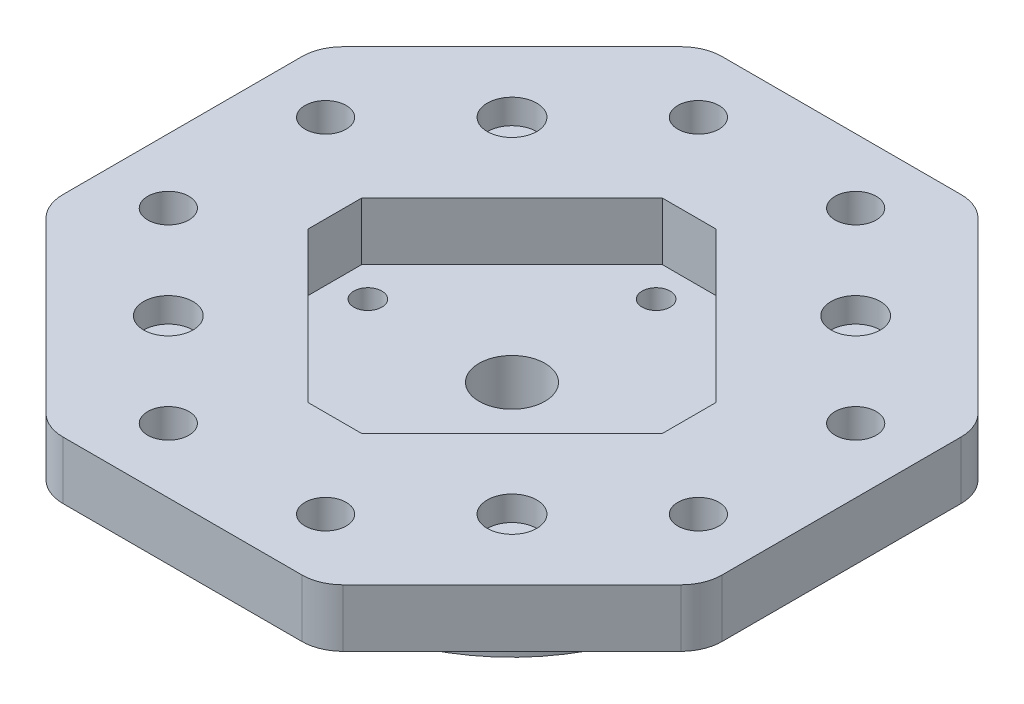
from build123d import *

# Parameters (mm, degrees)
SKETCH_1_R          = 27.5
EXTRUDE_1_DEPTH     = 3
SKETCH_2_R          = 22.5
EXTRUDE_2_DEPTH     = 10
CUT_EXTRUDE_1_REACH = 43.006
SKETCH_3_R          = 1.7
SKETCH_3_R_2        = 4
EXTRUDE_3_DEPTH     = 7
SKETCH_6_R          = 3
CUT_EXTRUDE_2_DEPTH = 3
CUT_EXTRUDE_3_REACH = 62
SKETCH_7_R          = 2.5
FILLET_1_R          = 5


with BuildPart() as part:
    # 草图1 → 凸台-拉伸1 (new body)
    with BuildSketch(Plane(origin=(0, 0, 0), x_dir=(1, 0, 0), z_dir=(0, 1, 0))):
        Circle(SKETCH_1_R)
    extrude(amount=-EXTRUDE_1_DEPTH)

    # 草图2 → 凸台-拉伸2 (add)
    with BuildSketch(Plane.XZ.offset(3)):
        Circle(SKETCH_2_R)
    extrude(amount=EXTRUDE_2_DEPTH)

    # 草图3 → 切除-拉伸1 (cut, up to next)
    with BuildSketch(Plane.XZ.offset(13), mode=Mode.PRIVATE) as cut_extrude_1_sk1:
        with Locations((0, 17.5)):
            Circle(SKETCH_3_R)
    cut_extrude_1_tool1 = extrude(cut_extrude_1_sk1.sketch, amount=-CUT_EXTRUDE_1_REACH, mode=Mode.PRIVATE) & part.part
    # 草图3 → 切除-拉伸1 (cut, up to next)
    with BuildSketch(Plane.XZ.offset(13), mode=Mode.PRIVATE) as cut_extrude_1_sk2:
        with Locations((17.5, 0)):
            Circle(SKETCH_3_R)
    cut_extrude_1_tool2 = extrude(cut_extrude_1_sk2.sketch, amount=-CUT_EXTRUDE_1_REACH, mode=Mode.PRIVATE) & part.part
    # 草图3 → 切除-拉伸1 (cut, up to next)
    with BuildSketch(Plane.XZ.offset(13), mode=Mode.PRIVATE) as cut_extrude_1_sk3:
        with Locations((0, -17.5)):
            Circle(SKETCH_3_R)
    cut_extrude_1_tool3 = extrude(cut_extrude_1_sk3.sketch, amount=-CUT_EXTRUDE_1_REACH, mode=Mode.PRIVATE) & part.part
    # 草图3 → 切除-拉伸1 (cut, up to next)
    with BuildSketch(Plane.XZ.offset(13), mode=Mode.PRIVATE) as cut_extrude_1_sk4:
        with Locations((-17.5, 0)):
            Circle(SKETCH_3_R)
    cut_extrude_1_tool4 = extrude(cut_extrude_1_sk4.sketch, amount=-CUT_EXTRUDE_1_REACH, mode=Mode.PRIVATE) & part.part
    # 草图3 → 切除-拉伸1 (cut, up to next)
    with BuildSketch(Plane.XZ.offset(13), mode=Mode.PRIVATE) as cut_extrude_1_sk5:
        Circle(SKETCH_3_R_2)
    cut_extrude_1_tool5 = extrude(cut_extrude_1_sk5.sketch, amount=-CUT_EXTRUDE_1_REACH, mode=Mode.PRIVATE) & part.part
    add(cut_extrude_1_tool1.solids().sort_by_distance((0, -13, 17.5))[0], mode=Mode.SUBTRACT)
    add(cut_extrude_1_tool2.solids().sort_by_distance((17.5, -13, 0))[0], mode=Mode.SUBTRACT)
    add(cut_extrude_1_tool3.solids().sort_by_distance((0, -13, -17.5))[0], mode=Mode.SUBTRACT)
    add(cut_extrude_1_tool4.solids().sort_by_distance((-17.5, -13, 0))[0], mode=Mode.SUBTRACT)
    add(cut_extrude_1_tool5.solids().sort_by_distance((0, -13, 0))[0], mode=Mode.SUBTRACT)

    # 草图4 → 凸台-拉伸3 (add)
    with BuildSketch(Plane(origin=(0, 0, 0), x_dir=(1, 0, 0), z_dir=(0, 1, 0))):
        Polygon((0, 40), (16.568542495, 40), (40, 16.568542495), (40, 0), (40, -16.568542495), (16.568542495, -40), (0, -40), (-16.568542495, -40), (-40, -16.568542495), (-40, 0), (-40, 16.568542495), (-16.568542495, 40), align=None)
        Polygon((0, 21.5), (3.248737342, 21.5), (21.5, 3.248737342), (21.5, 0), (21.5, -3.248737342), (3.248737342, -21.5), (0, -21.5), (-3.248737342, -21.5), (-21.5, -3.248737342), (-21.5, 0), (-21.5, 3.248737342), (-3.248737342, 21.5), align=None, mode=Mode.SUBTRACT)
    extrude(amount=EXTRUDE_3_DEPTH)

    # 草图6 → 切除-拉伸2 (cut)
    with BuildSketch(Plane(origin=(0, 7, 0), x_dir=(1, 0, 0), z_dir=(0, 1, 0))):
        with Locations((20.859650045, 20.859650045)):
            Circle(SKETCH_6_R)
        with Locations((20.859650045, -20.859650045)):
            Circle(SKETCH_6_R)
        with Locations((-20.859650045, -20.859650045)):
            Circle(SKETCH_6_R)
        with Locations((-20.859650045, 20.859650045)):
            Circle(SKETCH_6_R)
    extrude(amount=-CUT_EXTRUDE_2_DEPTH, mode=Mode.SUBTRACT)

    # 草图7 → 切除-拉伸3 (cut, up to next)
    with BuildSketch(Plane(origin=(0, 7, 0), x_dir=(1, 0, 0), z_dir=(0, 1, 0)), mode=Mode.PRIVATE) as cut_extrude_3_sk1:
        with Locations((9.545941546, 32.173358544)):
            Circle(SKETCH_7_R)
    cut_extrude_3_tool1 = extrude(cut_extrude_3_sk1.sketch, amount=-CUT_EXTRUDE_3_REACH, mode=Mode.PRIVATE) & part.part
    # 草图7 → 切除-拉伸3 (cut, up to next)
    with BuildSketch(Plane(origin=(0, 7, 0), x_dir=(1, 0, 0), z_dir=(0, 1, 0)), mode=Mode.PRIVATE) as cut_extrude_3_sk2:
        with Locations((32.173358544, 9.545941546)):
            Circle(SKETCH_7_R)
    cut_extrude_3_tool2 = extrude(cut_extrude_3_sk2.sketch, amount=-CUT_EXTRUDE_3_REACH, mode=Mode.PRIVATE) & part.part
    # 草图7 → 切除-拉伸3 (cut, up to next)
    with BuildSketch(Plane(origin=(0, 7, 0), x_dir=(1, 0, 0), z_dir=(0, 1, 0)), mode=Mode.PRIVATE) as cut_extrude_3_sk3:
        with Locations((32.173358544, -9.545941546)):
            Circle(SKETCH_7_R)
    cut_extrude_3_tool3 = extrude(cut_extrude_3_sk3.sketch, amount=-CUT_EXTRUDE_3_REACH, mode=Mode.PRIVATE) & part.part
    # 草图7 → 切除-拉伸3 (cut, up to next)
    with BuildSketch(Plane(origin=(0, 7, 0), x_dir=(1, 0, 0), z_dir=(0, 1, 0)), mode=Mode.PRIVATE) as cut_extrude_3_sk4:
        with Locations((9.545941546, -32.173358544)):
            Circle(SKETCH_7_R)
    cut_extrude_3_tool4 = extrude(cut_extrude_3_sk4.sketch, amount=-CUT_EXTRUDE_3_REACH, mode=Mode.PRIVATE) & part.part
    # 草图7 → 切除-拉伸3 (cut, up to next)
    with BuildSketch(Plane(origin=(0, 7, 0), x_dir=(1, 0, 0), z_dir=(0, 1, 0)), mode=Mode.PRIVATE) as cut_extrude_3_sk5:
        with Locations((-9.545941546, -32.173358544)):
            Circle(SKETCH_7_R)
    cut_extrude_3_tool5 = extrude(cut_extrude_3_sk5.sketch, amount=-CUT_EXTRUDE_3_REACH, mode=Mode.PRIVATE) & part.part
    # 草图7 → 切除-拉伸3 (cut, up to next)
    with BuildSketch(Plane(origin=(0, 7, 0), x_dir=(1, 0, 0), z_dir=(0, 1, 0)), mode=Mode.PRIVATE) as cut_extrude_3_sk6:
        with Locations((-32.173358544, -9.545941546)):
            Circle(SKETCH_7_R)
    cut_extrude_3_tool6 = extrude(cut_extrude_3_sk6.sketch, amount=-CUT_EXTRUDE_3_REACH, mode=Mode.PRIVATE) & part.part
    # 草图7 → 切除-拉伸3 (cut, up to next)
    with BuildSketch(Plane(origin=(0, 7, 0), x_dir=(1, 0, 0), z_dir=(0, 1, 0)), mode=Mode.PRIVATE) as cut_extrude_3_sk7:
        with Locations((-32.173358544, 9.545941546)):
            Circle(SKETCH_7_R)
    cut_extrude_3_tool7 = extrude(cut_extrude_3_sk7.sketch, amount=-CUT_EXTRUDE_3_REACH, mode=Mode.PRIVATE) & part.part
    # 草图7 → 切除-拉伸3 (cut, up to next)
    with BuildSketch(Plane(origin=(0, 7, 0), x_dir=(1, 0, 0), z_dir=(0, 1, 0)), mode=Mode.PRIVATE) as cut_extrude_3_sk8:
        with Locations((-9.545941546, 32.173358544)):
            Circle(SKETCH_7_R)
    cut_extrude_3_tool8 = extrude(cut_extrude_3_sk8.sketch, amount=-CUT_EXTRUDE_3_REACH, mode=Mode.PRIVATE) & part.part
    add(cut_extrude_3_tool1.solids().sort_by_distance((9.545942, 7, -32.173359))[0], mode=Mode.SUBTRACT)
    add(cut_extrude_3_tool2.solids().sort_by_distance((32.173359, 7, -9.545942))[0], mode=Mode.SUBTRACT)
    add(cut_extrude_3_tool3.solids().sort_by_distance((32.173359, 7, 9.545942))[0], mode=Mode.SUBTRACT)
    add(cut_extrude_3_tool4.solids().sort_by_distance((9.545942, 7, 32.173359))[0], mode=Mode.SUBTRACT)
    add(cut_extrude_3_tool5.solids().sort_by_distance((-9.545942, 7, 32.173359))[0], mode=Mode.SUBTRACT)
    add(cut_extrude_3_tool6.solids().sort_by_distance((-32.173359, 7, 9.545942))[0], mode=Mode.SUBTRACT)
    add(cut_extrude_3_tool7.solids().sort_by_distance((-32.173359, 7, -9.545942))[0], mode=Mode.SUBTRACT)
    add(cut_extrude_3_tool8.solids().sort_by_distance((-9.545942, 7, -32.173359))[0], mode=Mode.SUBTRACT)

    # 圆角1
    fillet_1_edges = [part.edges().sort_by_distance(p)[0] for p in [
        (-40, 3.5, -16.568542495),
        (-16.568542495, 3.5, -40),
        (16.568542495, 3.5, -40),
        (40, 3.5, -16.568542495),
        (40, 3.5, 16.568542495),
        (16.568542495, 3.5, 40),
        (-40, 3.5, 16.568542495),
        (-16.568542495, 3.5, 40),
    ]]
    fillet(fillet_1_edges, radius=FILLET_1_R)


solid = part.part
